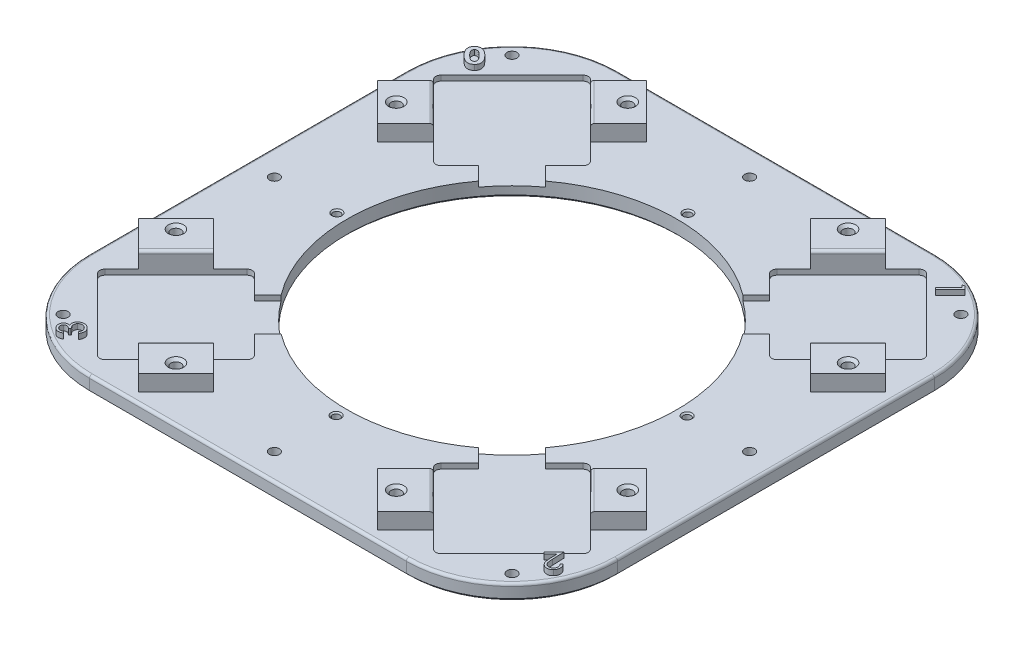
from build123d import *

# Parameters (mm, degrees)
SKETCH_1_W               = 200
SKETCH_1_H               = 200
SKETCH_1_R               = 1.9
EXTRUDE_1_DEPTH          = 6
CUT_EXTRUDE_1_DEPTH      = 2
FILLET_1_R               = 2
EXTRUDE_3_DEPTH          = 6
FILLET_4_R               = 40
SKETCH_4_R               = 1.9
CUT_EXTRUDE_2_DEPTH      = 8
SKETCH_7_R               = 12
SKETCH_7_W               = 40
SKETCH_7_H               = 12
SKETCH_7_W_2             = 12
SKETCH_7_H_2             = 40
CUT_EXTRUDE_3_DEPTH      = 6
CUT_EXTRUDE_4_DEPTH      = 2
FILLET_6_R               = 1
SKETCH_9_R               = 1.4
CUT_EXTRUDE_5_DEPTH      = 10
EXTRUDE_6_DEPTH          = 2
FILLET_9_R               = 1
CUT_EXTRUDE_6_DEPTH      = 142.548578234
CUT_EXTRUDE_6_DEPTH_BACK = 142.548578234
SKETCH_11_R              = 62.5
CHAMFER_1_SIZE           = 1
CHAMFER_2_SIZE           = 1
CHAMFER_3_SIZE           = 0.5


with BuildPart() as part:
    # Эскиз1 → Бобышка-Вытянуть1 (new body)
    with BuildSketch(Plane(origin=(0, 0, 0), x_dir=(1, 0, 0), z_dir=(0, 1, 0))):
        Rectangle(SKETCH_1_W, SKETCH_1_H)
        with Locations((-90, 0)):
            Circle(SKETCH_1_R, mode=Mode.SUBTRACT)
        with Locations((0, 90)):
            Circle(SKETCH_1_R, mode=Mode.SUBTRACT)
        with Locations((90, 0)):
            Circle(SKETCH_1_R, mode=Mode.SUBTRACT)
        with Locations((0, -90)):
            Circle(SKETCH_1_R, mode=Mode.SUBTRACT)
        with Locations((-85, 85)):
            Circle(SKETCH_1_R, mode=Mode.SUBTRACT)
        with Locations((85, 85)):
            Circle(SKETCH_1_R, mode=Mode.SUBTRACT)
        with Locations((85, -85)):
            Circle(SKETCH_1_R, mode=Mode.SUBTRACT)
        with Locations((-85, -85)):
            Circle(SKETCH_1_R, mode=Mode.SUBTRACT)
    extrude(amount=EXTRUDE_1_DEPTH)

    # Эскиз2 → Вырез-Вытянуть1 (cut)
    with BuildSketch(Plane(origin=(0, 6, 0), x_dir=(1, 0, 0), z_dir=(0, 1, 0))):
        Polygon((63.639610307, 33.941125497), (33.941125497, 63.639610307), (63.639610307, 93.338095117), (93.338095117, 63.639610307), align=None)
        Polygon((33.941125497, -63.639610307), (63.639610307, -33.941125497), (93.338095117, -63.639610307), (63.639610307, -93.338095117), align=None)
        Polygon((-63.639610307, -33.941125497), (-33.941125497, -63.639610307), (-63.639610307, -93.338095117), (-93.338095117, -63.639610307), align=None)
        Polygon((-33.941125497, 63.639610307), (-63.639610307, 33.941125497), (-93.338095117, 63.639610307), (-63.639610307, 93.338095117), align=None)
    extrude(amount=-CUT_EXTRUDE_1_DEPTH, mode=Mode.SUBTRACT)

    # Скругление1
    fillet_1_edges = [part.edges().sort_by_distance(p)[0] for p in [
        (63.639610307, 5, -33.941125497),
        (33.941125497, 5, -63.639610307),
        (93.338095117, 5, -63.639610307),
        (63.639610307, 5, -93.338095117),
        (-63.639610307, 5, -93.338095117),
        (-63.639610307, 5, -33.941125497),
        (-93.338095117, 5, -63.639610307),
        (-33.941125497, 5, -63.639610307),
        (63.639610307, 5, 93.338095117),
        (93.338095117, 5, 63.639610307),
        (63.639610307, 5, 33.941125497),
        (33.941125497, 5, 63.639610307),
        (-63.639610307, 5, 93.338095117),
        (-33.941125497, 5, 63.639610307),
        (-63.639610307, 5, 33.941125497),
        (-93.338095117, 5, 63.639610307),
    ]]
    fillet(fillet_1_edges, radius=FILLET_1_R)

    # Эскиз3 → Бобышка-Вытянуть3 (add)
    with BuildSketch(Plane(origin=(0, 6, 0), x_dir=(1, 0, 0), z_dir=(0, 1, 0))):
        Polygon((41.71930009, 71.4177849), (55.861435714, 85.559920524), (45.254833996, 96.166522241), (31.112698372, 82.024386618), align=None)
        Polygon((85.559920524, 55.861435714), (96.166522241, 45.254833996), (82.024386618, 31.112698372), (71.4177849, 41.71930009), align=None)
        Polygon((71.4177849, -41.71930009), (85.559920524, -55.861435714), (96.166522241, -45.254833996), (82.024386618, -31.112698372), align=None)
        Polygon((31.112698372, -82.024386618), (45.254833996, -96.166522241), (55.861435714, -85.559920524), (41.71930009, -71.4177849), align=None)
        Polygon((-41.71930009, -71.4177849), (-55.861435714, -85.559920524), (-45.254833996, -96.166522241), (-31.112698372, -82.024386618), align=None)
        Polygon((-85.559920524, -55.861435714), (-96.166522241, -45.254833996), (-82.024386618, -31.112698372), (-71.4177849, -41.71930009), align=None)
        Polygon((-71.4177849, 41.71930009), (-85.559920524, 55.861435714), (-96.166522241, 45.254833996), (-82.024386618, 31.112698372), align=None)
        Polygon((-31.112698372, 82.024386618), (-45.254833996, 96.166522241), (-55.861435714, 85.559920524), (-41.71930009, 71.4177849), align=None)
    extrude(amount=EXTRUDE_3_DEPTH)

    # Скругление4
    fillet_4_edges = [part.edges().sort_by_distance(p)[0] for p in [
        (100, 3, -100),
        (100, 3, 100),
        (-100, 3, 100),
        (-100, 3, -100),
    ]]
    fillet(fillet_4_edges, radius=FILLET_4_R)

    # Эскиз4 → Вырез-Вытянуть2 (cut)
    with BuildSketch(Plane(origin=(0, 12, 0), x_dir=(1, 0, 0), z_dir=(0, 1, 0))):
        with Locations((41.71930009, 85.559920524)):
            Circle(SKETCH_4_R)
        with Locations((85.559920524, 41.71930009)):
            Circle(SKETCH_4_R)
        with Locations((85.559920524, -41.71930009)):
            Circle(SKETCH_4_R)
        with Locations((41.71930009, -85.559920524)):
            Circle(SKETCH_4_R)
        with Locations((-41.71930009, -85.559920524)):
            Circle(SKETCH_4_R)
        with Locations((-85.559920524, -41.71930009)):
            Circle(SKETCH_4_R)
        with Locations((-85.559920524, 41.71930009)):
            Circle(SKETCH_4_R)
        with Locations((-41.71930009, 85.559920524)):
            Circle(SKETCH_4_R)
    extrude(amount=-CUT_EXTRUDE_2_DEPTH, mode=Mode.SUBTRACT)

    # Эскиз7 → Вырез-Вытянуть3 (cut)
    with BuildSketch(Plane(origin=(0, 6, 0), x_dir=(1, 0, 0), z_dir=(0, 1, 0))):
        with Locations((28.284271247, 28.284271247)):
            Circle(SKETCH_7_R)
        with Locations((28.284271247, -28.284271247)):
            Circle(SKETCH_7_R)
        with Locations((-28.284271247, -28.284271247)):
            Circle(SKETCH_7_R)
        with Locations((-28.284271247, 28.284271247)):
            Circle(SKETCH_7_R)
        with Locations((40, 0)):
            Rectangle(SKETCH_7_W, SKETCH_7_H)
        with Locations((0, 40)):
            Rectangle(SKETCH_7_W_2, SKETCH_7_H_2)
        with Locations((0, -40)):
            Rectangle(SKETCH_7_W_2, SKETCH_7_H_2)
        with Locations((-40, 0)):
            Rectangle(SKETCH_7_W, SKETCH_7_H)
    extrude(amount=-CUT_EXTRUDE_3_DEPTH, mode=Mode.SUBTRACT)

    # Эскиз8 → Вырез-Вытянуть4 (cut)
    with BuildSketch(Plane(origin=(0, 6, 0), x_dir=(1, 0, 0), z_dir=(0, 1, 0))):
        Polygon((44.547727215, 31.819805153), (31.819805153, 44.547727215), (53.033008589, 65.76093065), (65.76093065, 53.033008589), align=None)
        Polygon((65.76093065, -53.033008589), (53.033008589, -65.76093065), (31.819805153, -44.547727215), (44.547727215, -31.819805153), align=None)
        Polygon((-44.547727215, -31.819805153), (-31.819805153, -44.547727215), (-53.033008589, -65.76093065), (-65.76093065, -53.033008589), align=None)
        Polygon((-65.76093065, 53.033008589), (-53.033008589, 65.76093065), (-31.819805153, 44.547727215), (-44.547727215, 31.819805153), align=None)
    extrude(amount=-CUT_EXTRUDE_4_DEPTH, mode=Mode.SUBTRACT)

    # Скругление6
    fillet_6_edges = [part.edges().sort_by_distance(p)[0] for p in [
        (78.488852712, 12, -48.790367902),
        (48.790367902, 12, -78.488852712),
        (-78.488852712, 12, 48.790367902),
        (-48.790367902, 12, 78.488852712),
        (48.790367902, 12, 78.488852712),
        (78.488852712, 12, 48.790367902),
        (-78.488852712, 12, -48.790367902),
        (-48.790367902, 12, -78.488852712),
    ]]
    fillet(fillet_6_edges, radius=FILLET_6_R)

    # Эскиз9 → Вырез-Вытянуть5 (cut)
    with BuildSketch(Plane(origin=(0, 6, 0), x_dir=(1, 0, 0), z_dir=(0, 1, 0))):
        with Locations((0.141931936, 66.467885895)):
            Circle(SKETCH_9_R)
        with Locations((-0.141931936, -66.467885895)):
            Circle(SKETCH_9_R)
        with Locations((66.467885895, -0.141931936)):
            Circle(SKETCH_9_R)
        with Locations((-66.467885895, 0.141931936)):
            Circle(SKETCH_9_R)
    extrude(amount=-CUT_EXTRUDE_5_DEPTH, mode=Mode.SUBTRACT)

    # Эскиз10 → Бобышка-Вытянуть6 (add)
    # profile 1 of 4: a face of its own
    with BuildSketch(Plane(origin=(0, 6, 0), x_dir=(1, 0, 0), z_dir=(0, 1, 0))):
        with BuildLine():
            add(Edge.make_bspline(
                [(-93.008725725, 78.748142248), (-92.957598681, 78.797521313), (-92.85676014, 78.894912293), (-92.695816741, 79.025623668), (-92.532835835, 79.143607747), (-92.364444707, 79.244705894), (-92.19338747, 79.333809788), (-92.016821516, 79.405990635), (-91.83577231, 79.461704551), (-91.651864556, 79.505826632), (-91.463065577, 79.533008597), (-91.270612251, 79.544105355), (-91.074440499, 79.539176393), (-90.875174478, 79.51794816), (-90.671949254, 79.481192006), (-90.46586329, 79.425437226), (-90.254902601, 79.357171516), (-90.040488058, 79.269212477), (-89.819864955, 79.163420892), (-89.593527751, 79.033863441), (-89.359570967, 78.882570897), (-89.117138773, 78.709656313), (-88.869800196, 78.51114685), (-88.612296924, 78.293135309), (-88.348308293, 78.050855484), (-88.172747767, 77.8784765), (-88.082443673, 77.789808915)],
                knots=[0, 0, 0, 0, 0.898182766, 1.771497688, 2.618542862, 3.439672004, 4.25211909, 5.054711465, 5.847125212, 6.644844624, 7.443249755, 8.254994895, 9.079117631, 9.921086753, 10.786032602, 11.686927653, 12.618018076, 13.587382576, 14.61431454, 15.709081657, 16.881705886, 18.135395254, 19.471648796, 20.88972771, 22.400151059, 24, 24, 24, 24], degree=3))
            add(Edge.make_bspline(
                [(-88.082443673, 77.789808915), (-87.99267599, 77.698463012), (-87.818629055, 77.521356129), (-87.574075163, 77.254376099), (-87.352755723, 76.995556331), (-87.155322982, 76.743444497), (-86.979453593, 76.499753648), (-86.827635494, 76.263265193), (-86.697172812, 76.035199404), (-86.593983854, 75.812528771), (-86.505762897, 75.597863606), (-86.435650692, 75.388405368), (-86.380204903, 75.184114783), (-86.341999183, 74.984749296), (-86.317124562, 74.790489333), (-86.308824987, 74.600690128), (-86.317259045, 74.415819605), (-86.339029871, 74.235495262), (-86.378224262, 74.059121756), (-86.433011633, 73.88543721), (-86.503667028, 73.713843244), (-86.590455303, 73.544917992), (-86.694786221, 73.379663841), (-86.810937292, 73.213769659), (-86.94605157, 73.051911723), (-87.045954632, 72.949414733), (-87.09686675, 72.89718071)],
                knots=[0, 0, 0, 0, 1.626693129, 3.153929617, 4.597923221, 5.951226613, 7.220381534, 8.41370076, 9.519612414, 10.554665343, 11.5286677, 12.466351198, 13.358440621, 14.215441504, 15.042756246, 15.844148676, 16.625203713, 17.391079629, 18.148401381, 18.916678168, 19.701702082, 20.502864672, 21.325687275, 22.182312009, 23.073678591, 24, 24, 24, 24], degree=3))
            add(Edge.make_bspline(
                [(-87.09686675, 72.89718071), (-87.149001816, 72.84614528), (-87.251598834, 72.745712247), (-87.415449357, 72.611920711), (-87.581095452, 72.493010238), (-87.748111845, 72.387124201), (-87.920307836, 72.299502255), (-88.094627597, 72.225293141), (-88.272021467, 72.16710318), (-88.452198674, 72.125173685), (-88.635693302, 72.099819479), (-88.822639538, 72.088904452), (-89.013082719, 72.090828854), (-89.207091086, 72.1143069), (-89.40536909, 72.145719544), (-89.606567507, 72.199199877), (-89.811492576, 72.264759097), (-90.022238393, 72.344954071), (-90.237893224, 72.447094582), (-90.460693886, 72.571345842), (-90.692551034, 72.717439447), (-90.930254984, 72.890031869), (-91.177219561, 73.084109407), (-91.432290045, 73.301626079), (-91.696875667, 73.541020342), (-91.871055441, 73.713771109), (-91.960648802, 73.802629428)],
                knots=[0, 0, 0, 0, 0.933090558, 1.836236452, 2.703091185, 3.541342316, 4.363641911, 5.172278286, 5.963363672, 6.749235136, 7.536057157, 8.330354457, 9.143829215, 9.968822976, 10.828425831, 11.710347207, 12.629007139, 13.581006501, 14.593064946, 15.679156618, 16.843448976, 18.097249152, 19.435871615, 20.861513249, 22.385647378, 24, 24, 24, 24], degree=3))
            add(Edge.make_bspline(
                [(-91.960648802, 73.802629428), (-92.083808079, 73.927961036), (-92.321358131, 74.169701086), (-92.642974702, 74.539928393), (-92.927306321, 74.894846854), (-93.16830981, 75.240335887), (-93.371354338, 75.572879883), (-93.528165963, 75.896472645), (-93.650478298, 76.206379417), (-93.697573804, 76.414092671), (-93.720264186, 76.514167889)],
                knots=[0, 0, 0, 0, 1.286987725, 2.482346486, 3.591022616, 4.616940247, 5.566609133, 6.441717498, 7.249227199, 8, 8, 8, 8], degree=3))
            add(Edge.make_bspline(
                [(-93.720264186, 76.514167889), (-93.73621609, 76.619695189), (-93.767435565, 76.826222703), (-93.769463604, 77.134773214), (-93.73708647, 77.432890992), (-93.662918531, 77.719164849), (-93.557667587, 77.996586653), (-93.410830123, 78.260518954), (-93.228823871, 78.514820834), (-93.083287813, 78.669100547), (-93.008725725, 78.748142248)],
                knots=[0, 0, 0, 0, 1.045976366, 2.04708071, 3.017702948, 3.979968869, 4.940634868, 5.921098241, 6.93492198, 8, 8, 8, 8], degree=3))
        make_face()
        with BuildLine():
            add(Edge.make_bspline(
                [(-91.968661622, 77.762565325), (-92.010462791, 77.716369621), (-92.09267178, 77.625518043), (-92.185599358, 77.466056849), (-92.247808891, 77.292789759), (-92.277000053, 77.138763868), (-92.281564988, 77.009210942), (-92.272569584, 76.906266824), (-92.255217222, 76.798367336), (-92.225720447, 76.685914195), (-92.185705795, 76.569081549), (-92.133366823, 76.447952044), (-92.070623007, 76.322116087), (-91.998518706, 76.18904091), (-91.910791112, 76.051145738), (-91.80930652, 75.904601817), (-91.691866402, 75.749325648), (-91.559047432, 75.584504399), (-91.409818285, 75.411433598), (-91.243944165, 75.230965793), (-91.065124091, 75.039589219), (-90.938036359, 74.911792703), (-90.872507776, 74.845898658)],
                knots=[0, 0, 0, 0, 1.075604722, 2.115356592, 3.167844591, 4.248203041, 4.812243559, 5.405508209, 6.032984943, 6.700942317, 7.414044194, 8.167617197, 8.981822607, 9.846245724, 10.784711884, 11.80756956, 12.929501316, 14.151980212, 15.469127066, 16.882155306, 18.392386567, 20, 20, 20, 20], degree=3))
            add(Edge.make_bspline(
                [(-90.872507776, 74.845898658), (-90.7864976, 74.761480543), (-90.621676348, 74.599710156), (-90.376186673, 74.375708535), (-90.142591105, 74.181411662), (-89.920993001, 74.01580443), (-89.712979922, 73.876185004), (-89.516195184, 73.766835437), (-89.332031918, 73.684611929), (-89.159202852, 73.630270157), (-88.995766399, 73.602382197), (-88.842298, 73.587529693), (-88.696426487, 73.594737092), (-88.558484062, 73.616713591), (-88.427977695, 73.656297414), (-88.306707853, 73.716054158), (-88.190628178, 73.788553381), (-88.124171611, 73.852114178), (-88.090456494, 73.884360197)],
                knots=[0, 0, 0, 0, 1.768629636, 3.389223978, 4.875842697, 6.225868878, 7.447880289, 8.54973518, 9.52566295, 10.403516369, 11.200100902, 11.95533547, 12.661618695, 13.336984531, 14.001570975, 14.653788248, 15.317032326, 16, 16, 16, 16], degree=3))
            add(Edge.make_bspline(
                [(-88.090456494, 73.884360197), (-88.060170206, 73.917273087), (-88.000655379, 73.981949384), (-87.928154313, 74.090301918), (-87.872339217, 74.205569408), (-87.835909962, 74.32905055), (-87.814669853, 74.458862384), (-87.812602281, 74.595619521), (-87.824773104, 74.739340345), (-87.846722465, 74.835951399), (-87.858084699, 74.885962761)],
                knots=[0, 0, 0, 0, 0.992959701, 1.951240279, 2.885912978, 3.828695135, 4.802734124, 5.800367936, 6.861345669, 8, 8, 8, 8], degree=3))
            add(Edge.make_bspline(
                [(-87.858084699, 74.885962761), (-87.877060945, 74.949998607), (-87.916921532, 75.084509222), (-88.007273396, 75.286598194), (-88.126064612, 75.49901867), (-88.272102307, 75.722527903), (-88.44647396, 75.957027887), (-88.648604001, 76.202021519), (-88.880645166, 76.45665197), (-89.04719527, 76.627386506), (-89.133725725, 76.716090966)],
                knots=[0, 0, 0, 0, 0.710523542, 1.492491535, 2.35044932, 3.300180637, 4.333113065, 5.460466168, 6.680595133, 8, 8, 8, 8], degree=3))
            add(Edge.make_bspline(
                [(-89.133725725, 76.716090966), (-89.222964963, 76.803682764), (-89.394241612, 76.971797487), (-89.648507303, 77.205255058), (-89.891423716, 77.406883944), (-90.117816027, 77.583359819), (-90.333231584, 77.728162558), (-90.534384646, 77.845045557), (-90.723026558, 77.930887678), (-90.898556487, 77.990917344), (-91.063656834, 78.023876163), (-91.218731192, 78.040982929), (-91.365199368, 78.039958248), (-91.503588791, 78.020388828), (-91.63445609, 77.984561165), (-91.755276867, 77.926461343), (-91.869565032, 77.855138121), (-91.935391485, 77.793645199), (-91.968661622, 77.762565325)],
                knots=[0, 0, 0, 0, 1.794997963, 3.44513516, 4.953227072, 6.325945798, 7.563759521, 8.676594079, 9.661550624, 10.534529874, 11.333105772, 12.073249666, 12.771110835, 13.429383314, 14.075074024, 14.709742177, 15.347875331, 16, 16, 16, 16], degree=3))
        make_face(mode=Mode.SUBTRACT)
    # profile 2 of 4: a face of its own
    with BuildSketch(Plane(origin=(0, 6, 0), x_dir=(1, 0, 0), z_dir=(0, 1, 0))):
        Polygon((78.440095754, 93.074368887), (79.541057292, 91.973407348), (73.941698318, 86.374048374), (73.385608575, 86.930138118), (78.436890626, 91.981420169), (77.557082933, 92.861227861), align=None)
    # profile 3 of 4: a face of its own
    with BuildSketch(Plane(origin=(0, 6, 0), x_dir=(1, 0, 0), z_dir=(0, 1, 0))):
        with BuildLine():
            Line((92.978731613, -74.683298044), (93.515590587, -74.14643907))
            add(Edge.make_bspline(
                [(93.515590587, -74.14643907), (93.57979168, -74.217561095), (93.705938599, -74.357306758), (93.872192198, -74.580565611), (94.0096643, -74.812483922), (94.124946647, -75.049578001), (94.215404454, -75.292959176), (94.277694742, -75.544127868), (94.316788413, -75.801118589), (94.328555137, -76.062538369), (94.318422495, -76.32287574), (94.281216893, -76.576781617), (94.220051936, -76.822145442), (94.134830229, -77.05845039), (94.025582223, -77.28616355), (93.889081572, -77.503018406), (93.730477042, -77.712924928), (93.608225903, -77.841999489), (93.546039305, -77.907657019)],
                knots=[0, 0, 0, 0, 1.097080493, 2.155622548, 3.181877021, 4.180734131, 5.171877943, 6.149826956, 7.139761318, 8.144411119, 9.14266836, 10.119602376, 11.078258423, 12.0343727, 12.992188754, 13.965052194, 14.964864601, 16, 16, 16, 16], degree=3))
            add(Edge.make_bspline(
                [(93.546039305, -77.907657019), (93.482090698, -77.969428879), (93.356687631, -78.090563349), (93.151429875, -78.244882669), (92.942680032, -78.37895674), (92.725313898, -78.484156569), (92.502307063, -78.567304392), (92.272879379, -78.625036467), (92.036408861, -78.657581549), (91.796858495, -78.662803423), (91.558717577, -78.647071576), (91.328114136, -78.610221179), (91.106309941, -78.554059657), (90.894170445, -78.476955727), (90.69100415, -78.378911034), (90.498450265, -78.258608397), (90.312382857, -78.122050971), (90.200365868, -78.014736799), (90.143795716, -77.960541634)],
                knots=[0, 0, 0, 0, 1.122093018, 2.200421744, 3.237554738, 4.251534574, 5.244276876, 6.239309773, 7.233678941, 8.25294369, 9.26061734, 10.244606756, 11.198736813, 12.14649875, 13.09110873, 14.042419092, 15.011394142, 16, 16, 16, 16], degree=3))
            add(Edge.make_bspline(
                [(90.143795716, -77.960541634), (90.06838982, -77.879576092), (89.91877248, -77.718927525), (89.733967572, -77.445845524), (89.584072127, -77.153182093), (89.489411425, -76.889885212), (89.430647816, -76.660895349), (89.391527922, -76.464896649), (89.354319473, -76.246967695), (89.323162154, -76.005743563), (89.29417061, -75.742397125), (89.270319478, -75.45596892), (89.251579707, -75.147093558), (89.241802351, -74.933312205), (89.236744434, -74.822721121)],
                knots=[0, 0, 0, 0, 1.186803905, 2.354808508, 3.527369274, 4.71059022, 5.350674727, 6.065137202, 6.856453041, 7.724624025, 8.676850923, 9.701662735, 10.811048734, 12, 12, 12, 12], degree=3))
            Line((89.236744434, -74.822721121), (89.12616751, -71.926887788))
            Line((89.12616751, -71.926887788), (86.541231613, -74.511823685))
            Line((86.541231613, -74.511823685), (86.00116751, -73.971759583))
            Line((86.00116751, -73.971759583), (89.804052126, -70.168874967))
            Line((89.804052126, -70.168874967), (89.975526485, -74.61919548))
            add(Edge.make_bspline(
                [(89.975526485, -74.61919548), (89.97940604, -74.72712057), (89.986860215, -74.934487794), (90.003890674, -75.233029494), (90.019624168, -75.50625937), (90.043566004, -75.75394261), (90.06564968, -75.976592217), (90.095425878, -76.173535946), (90.124676221, -76.345461481), (90.168824981, -76.538523396), (90.23936523, -76.755529595), (90.356972999, -76.992365375), (90.498540406, -77.21240251), (90.616674642, -77.339291696), (90.675846998, -77.402849326)],
                knots=[0, 0, 0, 0, 1.320717269, 2.537625612, 3.657091802, 4.667335419, 5.580706193, 6.392834347, 7.10280944, 7.712944814, 8.814093938, 9.883466006, 10.93984752, 12, 12, 12, 12], degree=3))
            add(Edge.make_bspline(
                [(90.675846998, -77.402849326), (90.715762518, -77.440491138), (90.794563147, -77.514803044), (90.923578393, -77.611670036), (91.059857654, -77.691744666), (91.203081359, -77.756245876), (91.352325662, -77.808417727), (91.509417042, -77.84322442), (91.673171622, -77.86207557), (91.841072337, -77.867216475), (92.009961942, -77.855516387), (92.175462222, -77.830692716), (92.335424905, -77.788442162), (92.488974446, -77.730963732), (92.63686883, -77.65745526), (92.779385889, -77.569475576), (92.916642426, -77.465111951), (93.000335801, -77.384492124), (93.042834177, -77.343554455)],
                knots=[0, 0, 0, 0, 0.999414226, 1.973028734, 2.933162718, 3.874301026, 4.831864631, 5.809753659, 6.800020608, 7.832465231, 8.866744497, 9.881594604, 10.878159325, 11.876387246, 12.86478581, 13.883411814, 14.925224832, 16, 16, 16, 16], degree=3))
            add(Edge.make_bspline(
                [(93.042834177, -77.343554455), (93.085971983, -77.29897834), (93.170746275, -77.211377487), (93.280021317, -77.067662313), (93.371539202, -76.917986932), (93.447322526, -76.763501475), (93.507260364, -76.604334053), (93.549404033, -76.439373624), (93.572814515, -76.2684341), (93.581008072, -76.093006632), (93.571727119, -75.914621837), (93.542273015, -75.73648388), (93.495192881, -75.558323393), (93.430044659, -75.380806329), (93.34279892, -75.20509369), (93.240953397, -75.028485632), (93.118160612, -74.853500614), (93.025950971, -74.740939253), (92.978731613, -74.683298044)],
                knots=[0, 0, 0, 0, 1.00435318, 1.973751999, 2.917821866, 3.842935876, 4.757667598, 5.668706735, 6.595277109, 7.548310303, 8.510417973, 9.48367281, 10.468252952, 11.4923997, 12.541405892, 13.642871744, 14.792945286, 16, 16, 16, 16], degree=3))
        make_face()
    # profile 4 of 4: a face of its own
    with BuildSketch(Plane(origin=(0, 6, 0), x_dir=(1, 0, 0), z_dir=(0, 1, 0))):
        with BuildLine():
            Line((-77.388715553, -92.454657468), (-76.802177092, -93.02196516))
            add(Edge.make_bspline(
                [(-76.802177092, -93.02196516), (-76.872074017, -93.066285105), (-77.009193948, -93.153229528), (-77.221245979, -93.263222601), (-77.431874401, -93.355769168), (-77.64204283, -93.427893024), (-77.851510765, -93.48173737), (-78.060252855, -93.514710119), (-78.26822027, -93.532269537), (-78.474255518, -93.526358935), (-78.676988968, -93.504358079), (-78.873717005, -93.464118869), (-79.064802464, -93.407793132), (-79.248731568, -93.334076039), (-79.426690369, -93.243281798), (-79.598271698, -93.136210179), (-79.762535153, -93.010024629), (-79.865353835, -92.915908177), (-79.917561707, -92.868119006)],
                knots=[0, 0, 0, 0, 1.169279398, 2.293827799, 3.37245145, 4.41823223, 5.430864929, 6.42509182, 7.401967133, 8.376183799, 9.33334128, 10.280982312, 11.210249107, 12.145386172, 13.077317515, 14.030476502, 14.999942152, 16, 16, 16, 16], degree=3))
            add(Edge.make_bspline(
                [(-79.917561707, -92.868119006), (-79.988920031, -92.793915351), (-80.13012374, -92.647081306), (-80.306994952, -92.399433841), (-80.450747659, -92.133673041), (-80.562173881, -91.854130293), (-80.638288532, -91.566288195), (-80.673674749, -91.278376936), (-80.670891848, -90.993695007), (-80.628901464, -90.716257597), (-80.552855322, -90.450259759), (-80.442808141, -90.204893605), (-80.306804124, -89.977972028), (-80.190611, -89.848268388), (-80.132305297, -89.783183109)],
                knots=[0, 0, 0, 0, 1.079631469, 2.136372602, 3.182766178, 4.244954198, 5.288217467, 6.299582755, 7.281027378, 8.267633372, 9.236679149, 10.175611233, 11.084521819, 12, 12, 12, 12], degree=3))
            add(Edge.make_bspline(
                [(-80.132305297, -89.783183109), (-80.071332651, -89.724753249), (-79.951762443, -89.610169563), (-79.748381213, -89.471190926), (-79.532010491, -89.364348043), (-79.301508127, -89.289802953), (-79.057050132, -89.248329314), (-78.799158916, -89.239790928), (-78.527911531, -89.261925886), (-78.346160961, -89.301335363), (-78.252497604, -89.321644647)],
                knots=[0, 0, 0, 0, 0.994959293, 1.951161675, 2.892524362, 3.833211752, 4.798837926, 5.80788833, 6.870316961, 8, 8, 8, 8], degree=3))
            add(Edge.make_bspline(
                [(-78.252497604, -89.321644647), (-78.2908941, -89.227417901), (-78.366455678, -89.04198635), (-78.433533784, -88.752543136), (-78.468825619, -88.462397129), (-78.460297874, -88.26936548), (-78.456023245, -88.172606186)],
                knots=[0, 0, 0, 0, 1.034463078, 2.035749934, 3.015397462, 4, 4, 4, 4], degree=3))
            add(Edge.make_bspline(
                [(-78.456023245, -88.172606186), (-78.449288881, -88.105111251), (-78.436049064, -87.972415657), (-78.394386167, -87.778644977), (-78.340246105, -87.592612574), (-78.271950602, -87.41388508), (-78.185386109, -87.244752842), (-78.086329088, -87.082127181), (-77.970712952, -86.92772678), (-77.883148966, -86.832672184), (-77.839036066, -86.784785673)],
                knots=[0, 0, 0, 0, 1.04938919, 2.063107758, 3.062796941, 4.047250166, 5.019961658, 6.00006311, 6.992473739, 8, 8, 8, 8], degree=3))
            add(Edge.make_bspline(
                [(-77.839036066, -86.784785673), (-77.757764137, -86.707011683), (-77.595555492, -86.551784486), (-77.314339011, -86.362283402), (-77.00690324, -86.211377214), (-76.678775657, -86.096957633), (-76.337780488, -86.021689696), (-75.992384551, -85.998456457), (-75.648247161, -86.020429174), (-75.30852581, -86.092358394), (-74.975836653, -86.206866008), (-74.658919531, -86.369981879), (-74.355276993, -86.571977286), (-74.173558247, -86.737405252), (-74.081023245, -86.821644647)],
                knots=[0, 0, 0, 0, 0.966121529, 1.928258222, 2.902202989, 3.904812497, 4.910491246, 5.896124049, 6.872277065, 7.867065951, 8.874013802, 9.889062967, 10.92506653, 12, 12, 12, 12], degree=3))
            add(Edge.make_bspline(
                [(-74.081023245, -86.821644647), (-74.021853204, -86.881667927), (-73.905378738, -86.999821968), (-73.750010399, -87.188779842), (-73.616060265, -87.384318945), (-73.501384782, -87.584883398), (-73.407951202, -87.792558543), (-73.335758423, -88.006211938), (-73.283928402, -88.225649401), (-73.254012973, -88.449994375), (-73.243405037, -88.678597891), (-73.258616666, -88.909429614), (-73.295934925, -89.142204022), (-73.356030565, -89.376896446), (-73.437638527, -89.614740521), (-73.544783279, -89.853551775), (-73.672760277, -90.094886692), (-73.773237898, -90.251289766), (-73.824612989, -90.331260032)],
                knots=[0, 0, 0, 0, 1.045386523, 2.057812277, 3.030335339, 3.9831449, 4.920592867, 5.851197628, 6.777212156, 7.713628621, 8.655634425, 9.611918591, 10.578438017, 11.576706329, 12.614247281, 13.694355822, 14.821103873, 16, 16, 16, 16], degree=3))
            Line((-73.824612989, -90.331260032), (-74.387112989, -89.786388237))
            add(Edge.make_bspline(
                [(-74.387112989, -89.786388237), (-74.356108499, -89.729521047), (-74.295703021, -89.618727748), (-74.216755615, -89.452142222), (-74.152845056, -89.290175233), (-74.101233485, -89.134547193), (-74.061745375, -88.985413058), (-74.03787435, -88.841628771), (-74.0254386, -88.703252914), (-74.028325632, -88.612793387), (-74.029741194, -88.568439519)],
                knots=[0, 0, 0, 0, 1.208474665, 2.354448952, 3.437297787, 4.455450756, 5.412846772, 6.31251137, 7.172595194, 8, 8, 8, 8], degree=3))
            add(Edge.make_bspline(
                [(-74.029741194, -88.568439519), (-74.034859604, -88.513754216), (-74.045091811, -88.404432883), (-74.083607887, -88.244282225), (-74.135192606, -88.087829609), (-74.200435306, -87.934539232), (-74.284661095, -87.786835222), (-74.385183264, -87.644176856), (-74.498874455, -87.503469008), (-74.585051384, -87.416022074), (-74.629100169, -87.371324134)],
                knots=[0, 0, 0, 0, 0.961215761, 1.921565418, 2.877526972, 3.845915068, 4.834977089, 5.850130758, 6.901108131, 8, 8, 8, 8], degree=3))
            add(Edge.make_bspline(
                [(-74.629100169, -87.371324134), (-74.681090431, -87.322723333), (-74.782445027, -87.227976466), (-74.946347893, -87.106489871), (-75.110690459, -87.000747278), (-75.281027643, -86.917143209), (-75.454113249, -86.850977835), (-75.631241254, -86.803553156), (-75.812608999, -86.778698861), (-75.995053098, -86.770559067), (-76.175866677, -86.78030301), (-76.350156794, -86.805831688), (-76.517207594, -86.845992364), (-76.675973132, -86.901663669), (-76.826644699, -86.974919386), (-76.969041379, -87.0634642), (-77.105388267, -87.165921189), (-77.187099009, -87.245903166), (-77.228459143, -87.286388237)],
                knots=[0, 0, 0, 0, 1.175407728, 2.291447812, 3.366826222, 4.401376563, 5.421356114, 6.425777831, 7.424712672, 8.441055237, 9.440185163, 10.412905177, 11.348740396, 12.27587154, 13.188083527, 14.111845111, 15.044258618, 16, 16, 16, 16], degree=3))
            add(Edge.make_bspline(
                [(-77.228459143, -87.286388237), (-77.279535789, -87.343676672), (-77.381130905, -87.457627482), (-77.499712365, -87.655724529), (-77.592090729, -87.869391226), (-77.651660421, -88.098638567), (-77.68282183, -88.334507466), (-77.679719441, -88.572073434), (-77.641973735, -88.806620658), (-77.583578611, -88.999765985), (-77.514478245, -89.154475969), (-77.450854739, -89.280094261), (-77.369835179, -89.411062603), (-77.274409568, -89.548591317), (-77.16717371, -89.695487967), (-77.043439646, -89.847826927), (-76.907482639, -90.009367385), (-76.808529826, -90.115870536), (-76.757305297, -90.171003621)],
                knots=[0, 0, 0, 0, 1.121186236, 2.230119901, 3.361455773, 4.518304567, 5.684940395, 6.834367639, 7.982224936, 9.152000404, 9.775180233, 10.460538472, 11.21144107, 12.026855747, 12.910381899, 13.872566936, 14.898699748, 16, 16, 16, 16], degree=3))
            Line((-76.757305297, -90.171003621), (-77.268523245, -90.698247211))
            add(Edge.make_bspline(
                [(-77.268523245, -90.698247211), (-77.334741975, -90.637662351), (-77.464455594, -90.518984727), (-77.674721718, -90.365511058), (-77.893339725, -90.238268001), (-78.117019946, -90.138197165), (-78.337856669, -90.066171049), (-78.549142261, -90.022294312), (-78.748678618, -90.01180744), (-78.935354408, -90.032599171), (-79.107876819, -90.081434292), (-79.26675635, -90.152405628), (-79.412233777, -90.246112213), (-79.495636262, -90.325050512), (-79.537754015, -90.364913878)],
                knots=[0, 0, 0, 0, 1.265456482, 2.478859708, 3.664135126, 4.827966215, 5.929008543, 6.935492065, 7.863532652, 8.735702181, 9.573157525, 10.382716827, 11.183281726, 12, 12, 12, 12], degree=3))
            add(Edge.make_bspline(
                [(-79.537754015, -90.364913878), (-79.566835094, -90.396326023), (-79.624336337, -90.458436421), (-79.696526522, -90.562084864), (-79.756029374, -90.671258332), (-79.803081897, -90.78690076), (-79.837938732, -90.907750185), (-79.860995191, -91.034995575), (-79.869606859, -91.167658934), (-79.868291906, -91.304874511), (-79.854677693, -91.443051203), (-79.824958806, -91.578642797), (-79.783618958, -91.710304709), (-79.728268952, -91.83776375), (-79.660897843, -91.962176959), (-79.578201221, -92.082039768), (-79.484225877, -92.199700167), (-79.412386344, -92.272065664), (-79.37589504, -92.308824134)],
                knots=[0, 0, 0, 0, 0.945622928, 1.869755011, 2.784173497, 3.690084153, 4.624650255, 5.560708084, 6.543661072, 7.559560387, 8.592687063, 9.607418322, 10.623523625, 11.63942294, 12.675449106, 13.746764168, 14.855455909, 16, 16, 16, 16], degree=3))
            add(Edge.make_bspline(
                [(-79.37589504, -92.308824134), (-79.31341616, -92.364332751), (-79.191190113, -92.472923025), (-78.983632536, -92.597570118), (-78.763503707, -92.682251946), (-78.570315062, -92.721099458), (-78.409608163, -92.72848978), (-78.281445256, -92.725873293), (-78.147312061, -92.709585749), (-78.00752194, -92.679373618), (-77.861262426, -92.641186153), (-77.708597774, -92.591302884), (-77.550032642, -92.528408132), (-77.443524486, -92.47971492), (-77.388715553, -92.454657468)],
                knots=[0, 0, 0, 0, 1.401169659, 2.741077084, 4.038764372, 5.345842331, 6.028511183, 6.737373733, 7.496180119, 8.293104039, 9.137291959, 10.033670791, 10.988130031, 12, 12, 12, 12], degree=3))
        make_face()
    extrude(amount=EXTRUDE_6_DEPTH)

    # Скругление9
    fillet_9_edges = [part.edges().sort_by_distance(p)[0] for p in [
        (88.284271247, 6, 88.284271247),
        (0, 6, 100),
        (-88.284271247, 6, 88.284271247),
        (-100, 6, 0),
        (-88.284271247, 6, -88.284271247),
        (0, 6, -100),
        (88.284271247, 6, -88.284271247),
        (100, 6, 0),
    ]]
    fillet(fillet_9_edges, radius=FILLET_9_R)

    # Эскиз11 → Вырез-Вытянуть6 (cut, two sides: drawn at the far end of the back side and taken through both)
    with BuildSketch(Plane(origin=(0, 6, 0), x_dir=(1, 0, 0), z_dir=(0, 1, 0)).offset(-CUT_EXTRUDE_6_DEPTH_BACK)):
        Circle(SKETCH_11_R)
    extrude(amount=CUT_EXTRUDE_6_DEPTH + CUT_EXTRUDE_6_DEPTH_BACK, mode=Mode.SUBTRACT)

    # Фаска1
    chamfer_1_edges = [part.edges().sort_by_distance(p)[0] for p in [
        (100, 0, 0),
        (88.284271247, 0, -88.284271247),
        (88.284271247, 0, 88.284271247),
        (0, 0, -100),
        (0, 0, 100),
        (-88.284271247, 0, -88.284271247),
        (-88.284271247, 0, 88.284271247),
        (-100, 0, 0),
        (-86.9, 0, 85),
        (83.1, 0, -85),
        (-91.9, 0, 0),
        (88.1, 0, 0),
        (-1.9, 0, -90),
        (-1.9, 0, 90),
        (-86.9, 0, -85),
        (83.1, 0, 85),
        (-67.867885895, 0, -0.141931936),
        (65.067885895, 0, 0.141931936),
        (-1.541931936, 0, 66.467885895),
        (-1.258068064, 0, -66.467885895),
        (-62.5, 0, 0),
    ]]
    chamfer(chamfer_1_edges, length=CHAMFER_1_SIZE)

    # Фаска2
    chamfer_2_edges = [part.edges().sort_by_distance(p)[0] for p in [
        (-87.459920524, 12, 41.71930009),
        (-43.61930009, 12, 85.559920524),
        (39.81930009, 12, 85.559920524),
        (83.659920524, 12, 41.71930009),
        (83.659920524, 12, -41.71930009),
        (39.81930009, 12, -85.559920524),
        (-87.459920524, 12, -41.71930009),
        (-43.61930009, 12, -85.559920524),
    ]]
    chamfer(chamfer_2_edges, length=CHAMFER_2_SIZE)

    # Фаска3
    chamfer_3_edges = [part.edges().sort_by_distance(p)[0] for p in [
        (-67.867885895, 6, -0.141931936),
        (-1.541931936, 6, 66.467885895),
        (65.067885895, 6, 0.141931936),
        (-1.258068064, 6, -66.467885895),
    ]]
    chamfer(chamfer_3_edges, length=CHAMFER_3_SIZE)


solid = part.part
